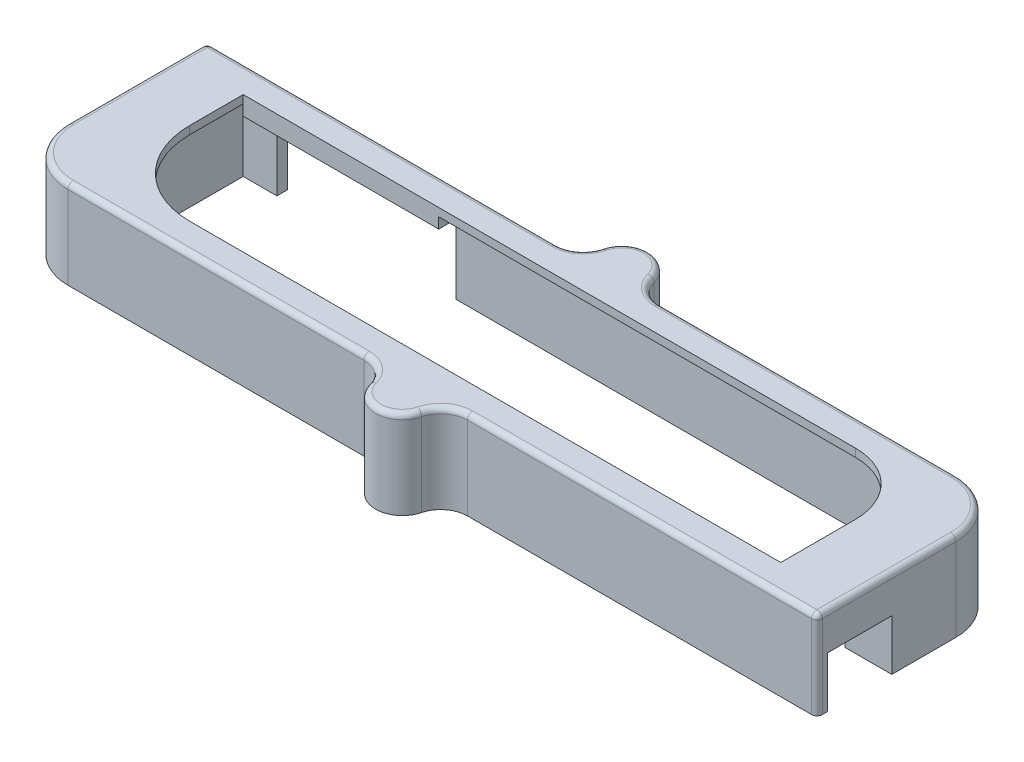
from build123d import *

# Parameters (mm, degrees)
SKETCH1_W           = 150
SKETCH1_H           = 36
BOSS_EXTRUDE1_DEPTH = 1.5
SKETCH2_W           = 150
SKETCH2_H           = 36
SKETCH2_W_2         = 132.5
SKETCH2_H_2         = 32
BOSS_EXTRUDE2_DEPTH = 15
SKETCH3_W           = 12
SKETCH3_H           = 9.5
CUT_EXTRUDE1_DEPTH  = 8.75
SKETCH4_W           = 33.5
SKETCH4_H           = 13
CUT_EXTRUDE2_DEPTH  = 2
BOSS_EXTRUDE4_DEPTH = 16.5
FILLET1_R           = 10
SKETCH5_R           = 1.375
CUT_EXTRUDE3_DEPTH  = 7.5
SKETCH8_W           = 36.55
SKETCH8_H           = 3.25
BOSS_EXTRUDE3_DEPTH = 2
FILLET2_R           = 5
FILLET3_R           = 1
CHAMFER1_SIZE       = 1
SKETCH10_W          = 113.75
SKETCH10_H          = 3.25
CUT_EXTRUDE4_DEPTH  = 0.25


with BuildPart() as part:
    # Sketch1 → Boss-Extrude1 (new body)
    with BuildSketch(Plane(origin=(0, 0, 0), x_dir=(1, 0, 0), z_dir=(0, 1, 0))):
        with Locations((-63, 12.75)):
            Rectangle(SKETCH1_W, SKETCH1_H)
        with BuildLine():
            Line((0, 0), (-110.5, 0))
            ThreePointArc((-110.5, 0), (-121.460155108, 4.539844892), (-126, 15.5))
            Line((-126, 15.5), (-126, 25.5))
            Line((-126, 25.5), (-11.5, 25.5))
            ThreePointArc((-11.5, 25.5), (-3.368272016, 22.131727984), (0, 14))
            Line((0, 14), (0, 0))
        make_face(mode=Mode.SUBTRACT)
    extrude(amount=BOSS_EXTRUDE1_DEPTH)

    # Sketch2 → Boss-Extrude2 (add)
    with BuildSketch(Plane.XZ):
        with Locations((-63, -12.75)):
            Rectangle(SKETCH2_W, SKETCH2_H)
        with Locations((-63, -12.75)):
            Rectangle(SKETCH2_W_2, SKETCH2_H_2, mode=Mode.SUBTRACT)
    extrude(amount=BOSS_EXTRUDE2_DEPTH)

    # Sketch3 → Cut-Extrude1 (cut)
    with BuildSketch(Plane.ZY.offset(-12)):
        with Locations((-2.75, -10.25)):
            Rectangle(SKETCH3_W, SKETCH3_H)
    extrude(amount=CUT_EXTRUDE1_DEPTH, mode=Mode.SUBTRACT)

    # Sketch4 → Cut-Extrude2 (cut)
    with BuildSketch(Plane.XY.offset(-30.75)):
        with Locations((-106.2, -8.5)):
            Rectangle(SKETCH4_W, SKETCH4_H)
    extrude(amount=CUT_EXTRUDE2_DEPTH, mode=Mode.SUBTRACT)

    # Sketch9 → Boss-Extrude4 (add)
    with BuildSketch(Plane(origin=(0, 1.5, 0), x_dir=(1, 0, 0), z_dir=(0, 1, 0))):
        with BuildLine():
            Line((-68, 33.25), (-68, 30.75))
            Line((-68, 30.75), (-58, 30.75))
            Line((-58, 30.75), (-58, 33.25))
            ThreePointArc((-58, 33.25), (-63, 38.25), (-68, 33.25))
        make_face()
        with BuildLine():
            Line((-58, -7.75), (-58, -5.25))
            Line((-58, -5.25), (-68, -5.25))
            Line((-68, -5.25), (-68, -7.75))
            ThreePointArc((-68, -7.75), (-63, -12.75), (-58, -7.75))
        make_face()
    extrude(amount=-BOSS_EXTRUDE4_DEPTH)

    # Fillet1
    fillet1_edges = [part.edges().sort_by_distance(p)[0] for p in [
        (12, -6.75, -30.75),
        (-138, -6.75, 5.25),
    ]]
    fillet(fillet1_edges, radius=FILLET1_R)

    # Sketch5 → Cut-Extrude3 (cut)
    with BuildSketch(Plane(origin=(0, -15, 0), x_dir=(1, 0, 0), z_dir=(0, 1, 0))):
        with Locations(Location((7.5, 21.5, 0), (0, 0, 270))):
            Circle(SKETCH5_R)
        with Locations((7.5, 4)):
            Circle(SKETCH5_R)
        with Locations(Location((-133.5, 4, 0), (0, 0, 270))):
            Circle(SKETCH5_R)
        with Locations(Location((-133.5, 21.5, 0), (0, 0, 270))):
            Circle(SKETCH5_R)
        with Locations(Location((-63, -7.75, 0), (0, 0, 270))):
            Circle(SKETCH5_R)
        with Locations(Location((-63, 33.25, 0), (0, 0, 270))):
            Circle(SKETCH5_R)
    extrude(amount=CUT_EXTRUDE3_DEPTH, mode=Mode.SUBTRACT)

    # Sketch8 → Boss-Extrude3 (add)
    with BuildSketch(Plane.XZ):
        with Locations((-107.725, -27.125)):
            Rectangle(SKETCH8_W, SKETCH8_H)
    extrude(amount=BOSS_EXTRUDE3_DEPTH)

    # Fillet2
    # the kernel refuses this fillet: 5 mm, written as the material it adds along each edge
    with BuildSketch(Plane(origin=(-58, 1.5, -30.75), x_dir=(1, 0, 0), z_dir=(0, -1, 0)), Plane(origin=(-68, 1.5, 5.25), x_dir=(-1, 0, 0), z_dir=(0, -1, 0))) as fillet2_piece_1:
        with BuildLine():
            CenterArc((4.682458366, -5), FILLET2_R, 90, 75.522487814)
            Line((-0.158770817, -3.75), (-0.642893736, -3.625))
            ThreePointArc((-0.642893736, -3.625), (-0.5, -2.5), (-0.5, 0))
            Line((-0.5, 0), (0, 0.5))
            Line((0, 0.5), (4.682458366, 0.5))
            Line((4.682458366, 0.5), (4.682458366, 0))
        make_face()
    extrude(amount=16.5)
    with BuildSketch(Plane(origin=(-68, 1.5, -30.75), x_dir=(-1, 0, 0), z_dir=(0, -1, 0))) as fillet2_piece_2:
        with BuildLine():
            CenterArc((4.682458366, 5), FILLET2_R, 194.477512186, 75.522487814)
            Line((-0.158770817, 3.75), (-0.642893736, 3.625))
            ThreePointArc((-0.642893736, 3.625), (-0.5, 2.5), (-0.5, 0))
            Line((-0.5, 0), (0, -0.5))
            Line((0, -0.5), (4.682458366, -0.5))
            Line((4.682458366, -0.5), (4.682458366, 0))
        make_face()
    extrude(amount=16.5)
    with BuildSketch(Plane(origin=(-58, 1.5, 5.25), x_dir=(-0.0423009875968097, 0, 0.9991049126334705), z_dir=(0, -1, 0))) as fillet2_piece_3:
        with BuildLine():
            CenterArc((4.79745195, -4.889772094), FILLET2_R, 102.053120737, 75.522487814)
            Line((-0.198072613, -4.678267156), (-0.69762507, -4.657116662))
            Line((-0.69762507, -4.657116662), (-0.499552456, 0.021150494))
            Line((-0.499552456, 0.021150494), (0.021150494, 0.499552456))
            ThreePointArc((0.021150494, 0.499552456), (2.518912775, 0.393799987), (3.648950348, 0.488977209))
            Line((3.648950348, 0.488977209), (3.753359585, 0))
        make_face()
    extrude(amount=16.5)
    # the kernel refuses this fillet: 5 mm, written as the material it takes off along each edge

    # Fillet3
    fillet3_edges = [part.edges().sort_by_distance(p)[0] for p in [
        (-25.658770817, 1.5, -30.75),
        (-100.341229183, 1.5, 5.25),
        (-135.071067812, 1.5, 2.321067812),
        (9.071067812, 1.5, -27.821067812),
        (12, 1.5, -7.75),
        (-63, 1.5, 12.75),
        (-20.658770817, 1.5, 5.25),
        (-63, 1.5, -38.25),
        (-105.341229183, 1.5, -30.75),
        (-56.379403813, 1.5, 6.297152925),
        (-69.620596187, 1.5, 6.297152925),
        (-56.379403813, 1.5, -31.797152925),
        (-69.620596187, 1.5, -31.797152925),
        (-138, 1.5, -17.75),
        (-138, -6.75, -30.75),
        (12, -6.75, 5.25),
    ]]
    fillet(fillet3_edges, radius=FILLET3_R)

    # Chamfer1
    chamfer1_edges = [part.edges().sort_by_distance(p)[0] for p in [
        (-63, -15, -34.625),
        (-133.5, -15, -5.375),
        (-133.5, -15, -22.875),
        (-63, -15, 6.375),
        (7.5, -15, -22.875),
    ]]
    chamfer(chamfer1_edges, length=CHAMFER1_SIZE)

    # Sketch10 → Cut-Extrude4 (cut)
    with BuildSketch(Plane.XZ):
        with Locations((-53.625, 1.625)):
            Rectangle(SKETCH10_W, SKETCH10_H)
    extrude(amount=-CUT_EXTRUDE4_DEPTH, mode=Mode.SUBTRACT)


solid = part.part
